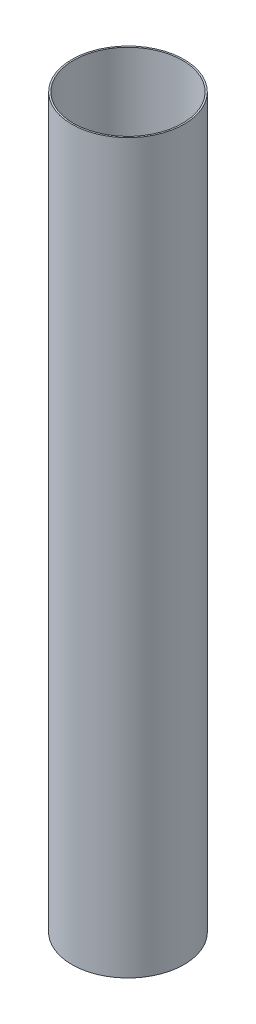
from build123d import *

# Parameters (mm, degrees)
BODY_TUBE_PROFILE_R        = 78.359
BODY_TUBE_PROFILE_R_2      = 76.2
BODY_TUBE_EXTRUSTION_DEPTH = 1016


with BuildPart() as part:
    # Body Tube Profile → Body Tube Extrustion (new body)
    with BuildSketch(Plane(origin=(0, 0, 0), x_dir=(1, 0, 0), z_dir=(0, 1, 0))):
        Circle(BODY_TUBE_PROFILE_R)
        Circle(BODY_TUBE_PROFILE_R_2, mode=Mode.SUBTRACT)
    extrude(amount=BODY_TUBE_EXTRUSTION_DEPTH)


solid = part.part
